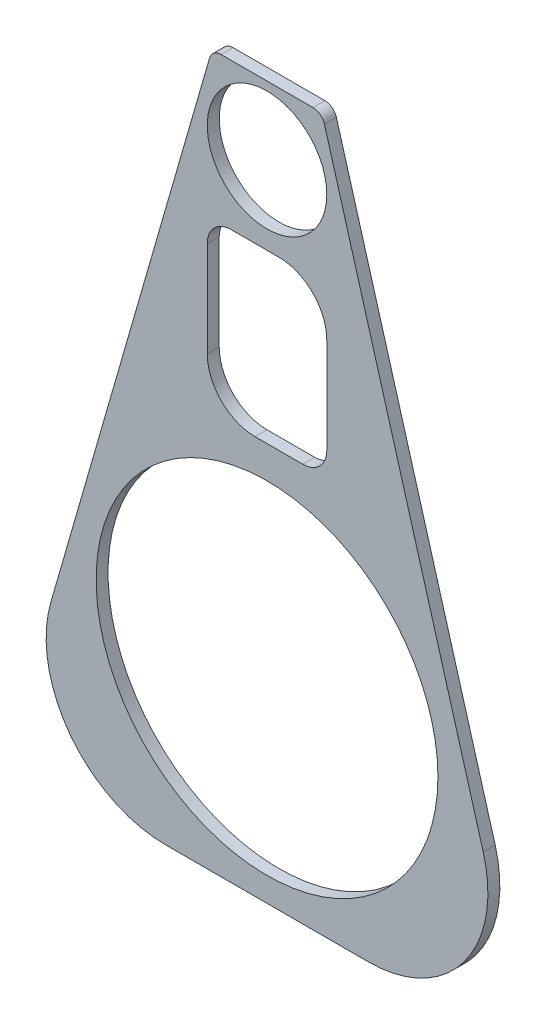
from build123d import *

# Parameters (mm, degrees)
SKETCH3_R           = 715
SKETCH3_R_2         = 250
BOSS_EXTRUDE1_DEPTH = 50


with BuildPart() as part:
    # Sketch3 → Boss-Extrude1 (new body)
    with BuildSketch(Plane.XY):
        with BuildLine():
            ThreePointArc((489.447387936, -1704.944747397), (888.974392718, -1505.574374096), (969.886005152, -1066.457437193))
            Line((969.886005152, -1066.457437193), (305.514251949, 1238.373568318))
            ThreePointArc((305.514251949, 1238.373568318), (287.533352897, 1264.477537776), (257.470390227, 1274.524837297))
            Line((257.470390227, 1274.524837297), (-126.839292875, 1274.524837297))
            ThreePointArc((-126.839292875, 1274.524837297), (-156.902255545, 1264.477537776), (-174.883154597, 1238.373568318))
            Line((-174.883154597, 1238.373568318), (-839.2549078, -1066.457437193))
            ThreePointArc((-839.2549078, -1066.457437193), (-758.343295367, -1505.574374096), (-358.816290584, -1704.944747397))
            Line((-358.816290584, -1704.944747397), (489.447387936, -1704.944747397))
        make_face()
        with Locations((65.315548676, -888.891859179)):
            Circle(SKETCH3_R, mode=Mode.SUBTRACT)
        with BuildLine():
            Line((215.315548676, -38.891859179), (15.315548676, -38.891859179))
            ThreePointArc((15.315548676, -38.891859179), (-126.105807561, 19.686784584), (-184.684451324, 161.108140821))
            Line((-184.684451324, 161.108140821), (-184.684451324, 561.108140821))
            ThreePointArc((-184.684451324, 561.108140821), (-155.395129443, 631.81881894), (-84.684451324, 661.108140821))
            Line((-84.684451324, 661.108140821), (115.315548676, 661.108140821))
            ThreePointArc((115.315548676, 661.108140821), (256.736904913, 602.529497059), (315.315548676, 461.108140821))
            Line((315.315548676, 461.108140821), (315.315548676, 61.108140821))
            ThreePointArc((315.315548676, 61.108140821), (286.026226794, -9.602537297), (215.315548676, -38.891859179))
        make_face(mode=Mode.SUBTRACT)
        with Locations((65.315548676, 988.536474279)):
            Circle(SKETCH3_R_2, mode=Mode.SUBTRACT)
    extrude(amount=BOSS_EXTRUDE1_DEPTH)


solid = part.part
